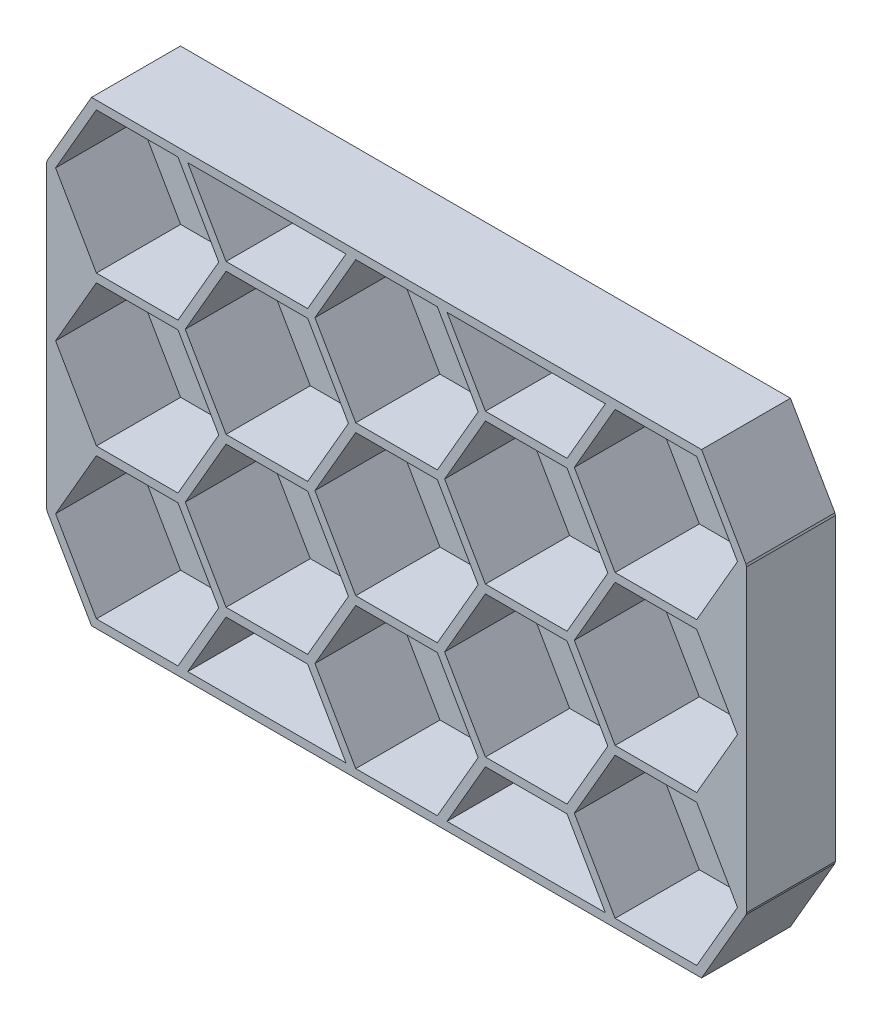
from build123d import *

# Parameters (mm, degrees)
EXTRUDE_THIN2_DEPTH = 19
BOSS_EXTRUDE1_DEPTH = 19
BOSS_EXTRUDE2_DEPTH = 1
BOSS_EXTRUDE4_DEPTH = 18


# Read off the part's stored shape, not the designer's step: Extrude-Thin2
with BuildPart() as part:
    # Extrude-Thin2 outline → Extrude-Thin2 (new body)
    with BuildSketch(Plane.XY):
        Polygon((-74.68025732, 32.45), (-73.900834456, 32), (-74.800834456, 32), (-74.800834456, -32), (-73.900834456, -32), (-74.68025732, -32.45), (-65.182845391, -48.9), (65.182845392, -48.9), (74.68025732, -32.45), (73.900834456, -32), (74.800834456, -32), (74.800834456, 32), (73.900834456, 32), (74.68025732, 32.45), (65.182845392, 48.9), (-65.182845392, 48.9), align=None)
        Polygon((-37.989647713, -32), (-46.707636777, -47.1), (-64.143614907, -47.1), (-72.861603972, -32), (-64.143614907, -16.9), (-46.707636777, -16.9), align=None, mode=Mode.SUBTRACT)
        Polygon((-36.430801986, -32.9), (-18.994823856, -32.9), (-10.796450034, -47.1), (-44.629175808, -47.1), align=None, mode=Mode.SUBTRACT)
        Polygon((-73.000834456, -3.358845727), (-65.702460634, -16), (-73.000834456, -28.641154273), align=None, mode=Mode.SUBTRACT)
        Polygon((-10.276834792, -16), (-18.994823856, -31.1), (-36.430801986, -31.1), (-45.148791051, -16), (-36.430801986, -0.9), (-18.994823856, -0.9), align=None, mode=Mode.SUBTRACT)
        Polygon((10.796450034, -47.1), (18.994823856, -32.9), (36.430801986, -32.9), (44.629175808, -47.1), align=None, mode=Mode.SUBTRACT)
        Polygon((-8.717989065, -16.9), (8.717989065, -16.9), (17.43597813, -32), (8.717989065, -47.1), (-8.717989065, -47.1), (-17.435978129, -32), align=None, mode=Mode.SUBTRACT)
        Polygon((46.707636777, -16.9), (64.143614907, -16.9), (72.861603972, -32), (64.143614907, -47.1), (46.707636777, -47.1), (37.989647713, -32), align=None, mode=Mode.SUBTRACT)
        Polygon((36.430801986, -0.9), (45.148791051, -16), (36.430801986, -31.1), (18.994823856, -31.1), (10.276834792, -16), (18.994823856, -0.9), align=None, mode=Mode.SUBTRACT)
        Polygon((73.000834456, -28.641154273), (65.702460634, -16), (73.000834456, -3.358845727), align=None, mode=Mode.SUBTRACT)
        Polygon((-37.989647713, 0), (-46.707636777, -15.1), (-64.143614907, -15.1), (-72.861603972, 0), (-64.143614907, 15.1), (-46.707636777, 15.1), align=None, mode=Mode.SUBTRACT)
        Polygon((-65.702460634, 16), (-73.000834456, 3.358845727), (-73.000834456, 28.641154273), align=None, mode=Mode.SUBTRACT)
        Polygon((-10.276834792, 16), (-18.994823856, 0.9), (-36.430801986, 0.9), (-45.148791051, 16), (-36.430801986, 31.1), (-18.994823856, 31.1), align=None, mode=Mode.SUBTRACT)
        Polygon((-37.989647713, 32), (-46.707636777, 16.9), (-64.143614907, 16.9), (-72.861603972, 32), (-64.143614907, 47.1), (-46.707636777, 47.1), align=None, mode=Mode.SUBTRACT)
        Polygon((-10.796450034, 47.1), (-18.994823856, 32.9), (-36.430801986, 32.9), (-44.629175808, 47.1), align=None, mode=Mode.SUBTRACT)
        Polygon((17.43597813, 0), (8.717989065, -15.1), (-8.717989065, -15.1), (-17.43597813, 0), (-8.717989065, 15.1), (8.717989065, 15.1), align=None, mode=Mode.SUBTRACT)
        Polygon((36.430801986, 0.9), (18.994823856, 0.9), (10.276834792, 16), (18.994823856, 31.1), (36.430801986, 31.1), (45.148791051, 16), align=None, mode=Mode.SUBTRACT)
        Polygon((72.861603972, 0), (64.143614907, -15.1), (46.707636777, -15.1), (37.989647713, 0), (46.707636777, 15.1), (64.143614907, 15.1), align=None, mode=Mode.SUBTRACT)
        Polygon((73.000834456, 28.641154273), (73.000834456, 3.358845727), (65.702460634, 16), align=None, mode=Mode.SUBTRACT)
        Polygon((17.43597813, 32), (8.717989065, 16.9), (-8.717989065, 16.9), (-17.43597813, 32), (-8.717989065, 47.1), (8.717989065, 47.1), align=None, mode=Mode.SUBTRACT)
        Polygon((36.430801986, 32.9), (18.994823856, 32.9), (10.796450034, 47.1), (44.629175808, 47.1), align=None, mode=Mode.SUBTRACT)
        Polygon((72.861603972, 32), (64.143614907, 16.9), (46.707636777, 16.9), (37.989647713, 32), (46.707636777, 47.1), (64.143614907, 47.1), align=None, mode=Mode.SUBTRACT)
    extrude(amount=EXTRUDE_THIN2_DEPTH)

    # Sketch2 → Boss-Extrude1 (add)
    with BuildSketch(Plane.XY.offset(19)):
        Polygon((73.900834456, -32), (74.68025732, -32.45), (74.800834456, -32), align=None)
        Polygon((74.68025732, 32.45), (74.800834456, 32), (73.900834456, 32), align=None)
        Polygon((-74.68025732, 32.45), (-74.800834456, 32), (-73.900834456, 32), align=None)
        Polygon((-74.68025732, -32.45), (-73.900834456, -32), (-74.800834456, -32), align=None)
    extrude(amount=-BOSS_EXTRUDE1_DEPTH)

    # Sketch3 → Boss-Extrude2 (add)
    with BuildSketch(Plane(origin=(0, 0, 0), x_dir=(-1, 0, 0), z_dir=(0, 0, -1))):
        Polygon((-74.68025732, 32.45), (-74.800834456, 32), (-74.800834456, -32), (-74.68025732, -32.45), (-65.182845392, -48.9), (65.182845391, -48.9), (74.68025732, -32.45), (74.800834456, -32), (74.800834456, 32), (74.68025732, 32.45), (65.182845392, 48.9), (-65.182845392, 48.9), align=None)
    extrude(amount=-BOSS_EXTRUDE2_DEPTH)

    # Sketch5 → Boss-Extrude4 (add)
    with BuildSketch(Plane.XY.offset(1)):
        Polygon((-73.000834456, 28.641154273), (-73.000834456, 3.358845727), (-65.702460634, 16), align=None)
        Polygon((-73.000834456, -28.641154273), (-65.702460634, -16), (-73.000834456, -3.358845727), align=None)
        Polygon((65.702460634, 16), (73.000834456, 3.358845727), (73.000834456, 28.641154273), align=None)
        Polygon((73.000834456, -3.358845727), (65.702460634, -16), (73.000834456, -28.641154273), align=None)
    extrude(amount=BOSS_EXTRUDE4_DEPTH)


solid = part.part
